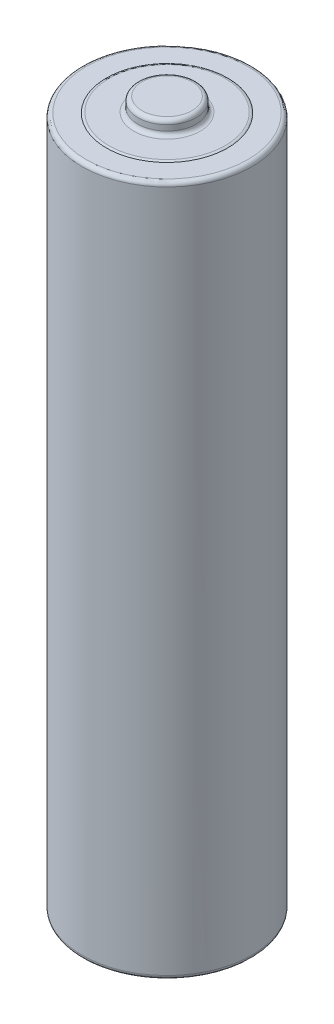
from build123d import *

# Parameters (mm, degrees)
FILLET1_R = 0.254
FILLET2_R = 0.254


with BuildPart() as part:
    # Sketch2 → Revolve1 (revolve)
    with BuildSketch(Plane.XY, mode=Mode.PRIVATE) as revolve1_sk:
        Polygon((0, -22.2), (3.3, -22.2), (3.3, -21.438), (5.25, -21.438), (5.25, 21.3), (3.75, 21.3), (3.75, 21.35), (1.8, 21.35), (1.8, 22.2), (0, 22.2), align=None)
    revolve(revolve1_sk.sketch.rotate(Axis((0, -28.28023606, 0), (0, 1, 0)), 90), axis=Axis((0, -28.28023606, 0), (0, 1, 0)))

    # Fillet1
    fillet1_edges = [part.edges().sort_by_distance(p)[0] for p in [
        (0, 21.3, 5.25),
        (0, -21.438, 5.25),
    ]]
    fillet(fillet1_edges, radius=FILLET1_R)

    # Fillet2
    # the kernel refuses this fillet: 0.254 mm, written as the material it adds along each edge
    with BuildSketch(Plane(origin=(0, 21.35, 0), x_dir=(0, 0, -1), z_dir=(1, 0, 0))) as fillet2_piece_1:
        with BuildLine():
            CenterArc((1.8 + FILLET2_R, FILLET2_R), FILLET2_R, 180, 90)
            Line((1.8, FILLET2_R), (1.8, 0))
            Line((1.8, 0), (1.8 + FILLET2_R, 0))
        make_face()
    revolve(axis=Axis((0, 21.35, 0), (0, 1, 0)))
    with BuildSketch(Plane(origin=(0, -21.438, 0), x_dir=(0, 0, -1), z_dir=(1, 0, 0))) as fillet2_piece_2:
        with BuildLine():
            CenterArc((3.3 + FILLET2_R, -FILLET2_R), FILLET2_R, 90, 90)
            Line((3.3, -FILLET2_R), (3.3, 0))
            Line((3.3, 0), (3.3 + FILLET2_R, 0))
        make_face()
    revolve(axis=Axis((0, -21.438, 0), (0, 1, 0)))
    # the kernel refuses this fillet: 0.254 mm, written as the material it takes off along each edge
    with BuildSketch(Plane(origin=(0, -22.2, 0), x_dir=(0, 0, -1), z_dir=(1, 0, 0))) as fillet2_2_piece_1:
        with BuildLine():
            CenterArc((3.3 - FILLET2_R, FILLET2_R), FILLET2_R, 270, 90)
            Line((3.3 - FILLET2_R, 0), (3.3, 0))
            Line((3.3, 0), (3.3, FILLET2_R))
        make_face()
    revolve(axis=Axis((0, -22.2, 0), (0, 1, 0)), mode=Mode.SUBTRACT)
    with BuildSketch(Plane(origin=(0, 22.2, 0), x_dir=(0, 0, -1), z_dir=(1, 0, 0))) as fillet2_2_piece_2:
        with BuildLine():
            CenterArc((1.8 - FILLET2_R, -FILLET2_R), FILLET2_R, 0, 90)
            Line((1.8 - FILLET2_R, 0), (1.8, 0))
            Line((1.8, 0), (1.8, -FILLET2_R))
        make_face()
    revolve(axis=Axis((0, 22.2, 0), (0, 1, 0)), mode=Mode.SUBTRACT)
    with BuildSketch(Plane(origin=(0, 21.35, 0), x_dir=(0, 0, -1), z_dir=(1, 0, 0))) as fillet2_2_piece_3:
        with BuildLine():
            CenterArc((3.59867254, -0.254), FILLET2_R, 53.431928983, 36.568071017)
            Line((3.59867254, 0), (3.75, 0))
            Line((3.75, 0), (3.75, -0.05))
        make_face()
    revolve(axis=Axis((0, 21.35, 0), (0, 1, 0)), mode=Mode.SUBTRACT)


solid = part.part
